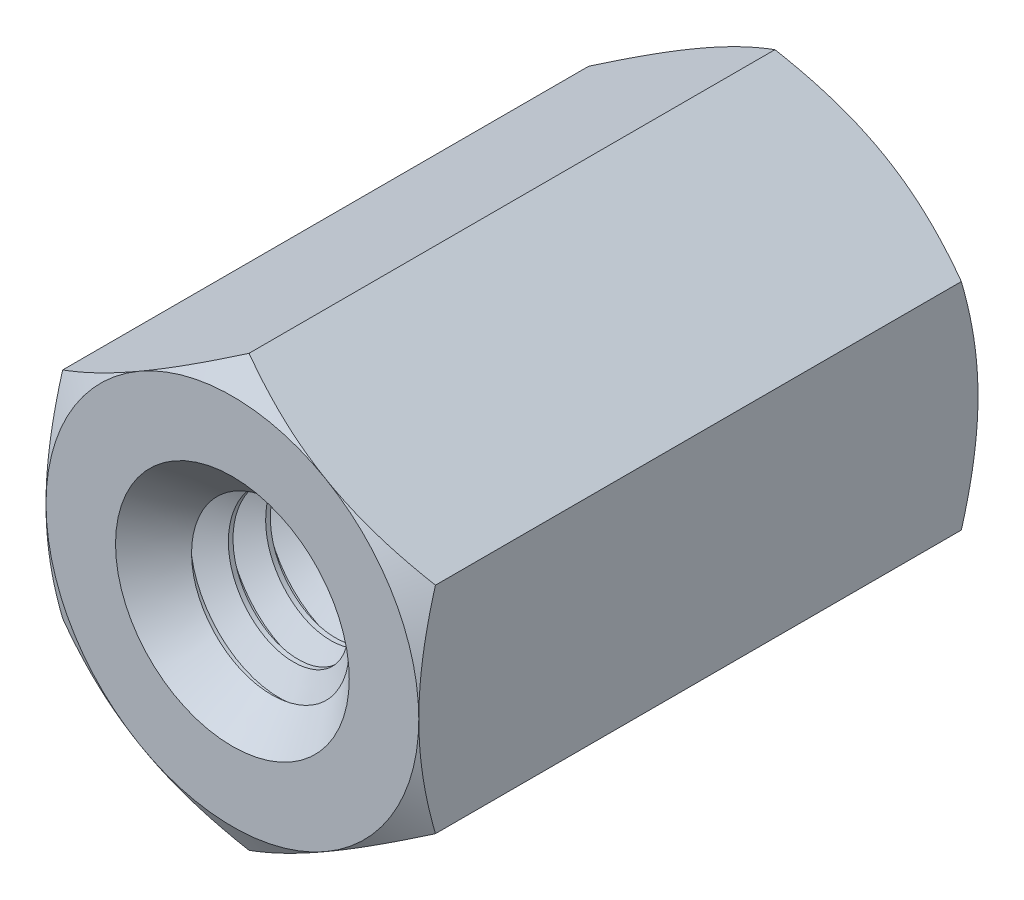
from build123d import *

# Parameters (mm, degrees)
EXTRUDE1_DEPTH     = 6
SKETCH2_OUTSIDE_W  = 34.5
SKETCH2_OUTSIDE_H  = 35.118
SKETCH2_OUTSIDE_R  = 2
CUT_EXTRUDE1_DEPTH = 7.733003292
CUT_EXTRUDE1_DRAFT = -60
SKETCH3_OUTSIDE_W  = 34.5
SKETCH3_OUTSIDE_H  = 35.118
SKETCH3_OUTSIDE_R  = 2
CUT_EXTRUDE2_DEPTH = 7.733003292
CUT_EXTRUDE2_DRAFT = -60
SKETCH4_R          = 1
CUT_EXTRUDE3_DEPTH = 7.733003292
SKETCH12_R         = 1
SKETCH12_R_2       = 0.740192379
EXTRUDE2_DEPTH     = 6
CUT_SWEEP1_PITCH   = 0.4


with BuildPart() as part:
    # Sketch1 → Extrude1 (new body)
    with BuildSketch(Plane.XY):
        Polygon((0, 2.309401077), (-2, 1.154700538), (-2, -1.154700538), (0, -2.309401077), (2, -1.154700538), (2, 1.154700538), align=None)
    extrude(amount=-EXTRUDE1_DEPTH)


with BuildPart() as cut_extrude1_tool:
    # Sketch2 outside → Cut-Extrude1 (with draft: the straight prism first)
    with BuildSketch(Plane.XY):
        Rectangle(SKETCH2_OUTSIDE_W, SKETCH2_OUTSIDE_H)
        Circle(SKETCH2_OUTSIDE_R, mode=Mode.SUBTRACT)
    extrude(amount=-CUT_EXTRUDE1_DEPTH)
    # Cut-Extrude1: the draft: its side faces are tilted about the plane it starts from
    cut_extrude1_sides = [cut_extrude1_tool.faces().sort_by_distance(p)[0] for p in [
        (0, -17.559, -3.866501646),
        (17.25, 0, -3.866501646),
        (0, 17.559, -3.866501646),
        (-17.25, 0, -3.866501646),
        (-2, 0, -3.866501646),
    ]]
    draft(cut_extrude1_sides, Plane.XY, CUT_EXTRUDE1_DRAFT)


with BuildPart() as part_1:
    add(part.part)

    # Cut-Extrude1: cut by cut_extrude1_tool
    add(cut_extrude1_tool.part, mode=Mode.SUBTRACT)


with BuildPart() as cut_extrude2_tool:
    # Sketch3 outside → Cut-Extrude2 (with draft: the straight prism first)
    with BuildSketch(Plane(origin=(0, 0, -6), x_dir=(-1, 0, 0), z_dir=(0, 0, -1))):
        Rectangle(SKETCH3_OUTSIDE_W, SKETCH3_OUTSIDE_H)
        Circle(SKETCH3_OUTSIDE_R, mode=Mode.SUBTRACT)
    extrude(amount=-CUT_EXTRUDE2_DEPTH)
    # Cut-Extrude2: the draft: its side faces are tilted about the plane it starts from
    cut_extrude2_sides = [cut_extrude2_tool.faces().sort_by_distance(p)[0] for p in [
        (0, -17.559, -2.133498354),
        (-17.25, 0, -2.133498354),
        (0, 17.559, -2.133498354),
        (17.25, 0, -2.133498354),
        (2, 0, -2.133498354),
    ]]
    draft(cut_extrude2_sides, Plane(origin=(0, 0, -6), x_dir=(-1, 0, 0), z_dir=(0, 0, -1)), CUT_EXTRUDE2_DRAFT)


with BuildPart() as part_2:
    add(part_1.part)

    # Cut-Extrude2: cut by cut_extrude2_tool
    add(cut_extrude2_tool.part, mode=Mode.SUBTRACT)

    # Sketch4 → Cut-Extrude3 (cut, through all)
    with BuildSketch(Plane.XY):
        Circle(SKETCH4_R)
    extrude(amount=-CUT_EXTRUDE3_DEPTH, mode=Mode.SUBTRACT)

    # Sketch12 → Extrude2 (add)
    with BuildSketch(Plane.XY):
        Circle(SKETCH12_R)
        Circle(SKETCH12_R_2, mode=Mode.SUBTRACT)
    extrude(amount=-EXTRUDE2_DEPTH)

    # Cut-Sweep1: the profile of Sketch9 profile screwed along a right-hand helix of 16 turns, 6 arcs to a turn; built about Z, then put on its axis
    cut_sweep1_z = Axis((0, 0, 0), (0, 0, 1))
    cut_sweep1_corners = [(1, 0, -0.2), (1, 0, -0.15), (0.739892379, 0, 0.000173205), (0.739892379, 0, -0.350173205)]
    with BuildLine(mode=Mode.PRIVATE) as cut_sweep1_profile:
        Line(cut_sweep1_corners[0], cut_sweep1_corners[1])
        Line(cut_sweep1_corners[1], cut_sweep1_corners[2])
        Line(cut_sweep1_corners[2], cut_sweep1_corners[3])
        Line(cut_sweep1_corners[3], cut_sweep1_corners[0])
    cut_sweep1_cap = Face(cut_sweep1_profile.wire())
    cut_sweep1_turn_angles = [0, 30, 60, 90, 120, 150, 180, 210, 240, 270, 300, 330, 360]
    cut_sweep1_turn_weights = [1, 0.8660254037844387, 1, 0.8660254037844387, 1, 0.8660254037844387, 1, 0.8660254037844387, 1, 0.8660254037844387, 1, 0.8660254037844387, 1]
    cut_sweep1_turn_rails = [Edge.make_bspline([Vector(p[0], p[1], 0).rotate(cut_sweep1_z, cut_sweep1_turn_angles[k]) / cut_sweep1_turn_weights[k] + Vector(0, 0, p[2] + CUT_SWEEP1_PITCH * cut_sweep1_turn_angles[k] / 360) for k in range(13)], [0, 0, 0, 1, 1, 2, 2, 3, 3, 4, 4, 5, 5, 6, 6, 6], 2, cut_sweep1_turn_weights) for p in cut_sweep1_corners]
    cut_sweep1_turn_sides = [Face.make_surface_from_curves(cut_sweep1_turn_rails[p[0]], cut_sweep1_turn_rails[p[1]]) for p in [(0, 1), (1, 2), (2, 3), (3, 0)]]
    cut_sweep1 = Plane(origin=(0, 0, 0), x_dir=(0, 1, 0), z_dir=(0, 0, -1)) * Solid(Shell([*[p.moved(Location((0, 0, CUT_SWEEP1_PITCH * i))) for i in range(16) for p in cut_sweep1_turn_sides], cut_sweep1_cap, cut_sweep1_cap.rotate(cut_sweep1_z, 5760).moved(Location((0, 0, CUT_SWEEP1_PITCH * 5760 / 360)))]))
    add(cut_sweep1, mode=Mode.SUBTRACT)

    # Cut-Extrude6 cone 1 section (through the dimple's axis) → Cut-Extrude6 (revolve, cut)
    with BuildSketch(Plane(origin=(0, 0, 0), x_dir=(0, -1, 0), z_dir=(1, 0, 0))):
        Polygon((0, 0), (1.254, 0), (0, 1.254), align=None)
    revolve(axis=Axis((0, 0, 0), (0, 0, -1)), mode=Mode.SUBTRACT)

    # Cut-Extrude7 cone 1 section (through the dimple's axis) → Cut-Extrude7 (revolve, cut)
    with BuildSketch(Plane(origin=(0, 0, -6), x_dir=(0, 1, 0), z_dir=(1, 0, 0))):
        Polygon((0, 0), (1.254, 0), (0, 1.254), align=None)
    revolve(axis=Axis((0, 0, -6), (0, 0, 1)), mode=Mode.SUBTRACT)


solid = part_2.part
